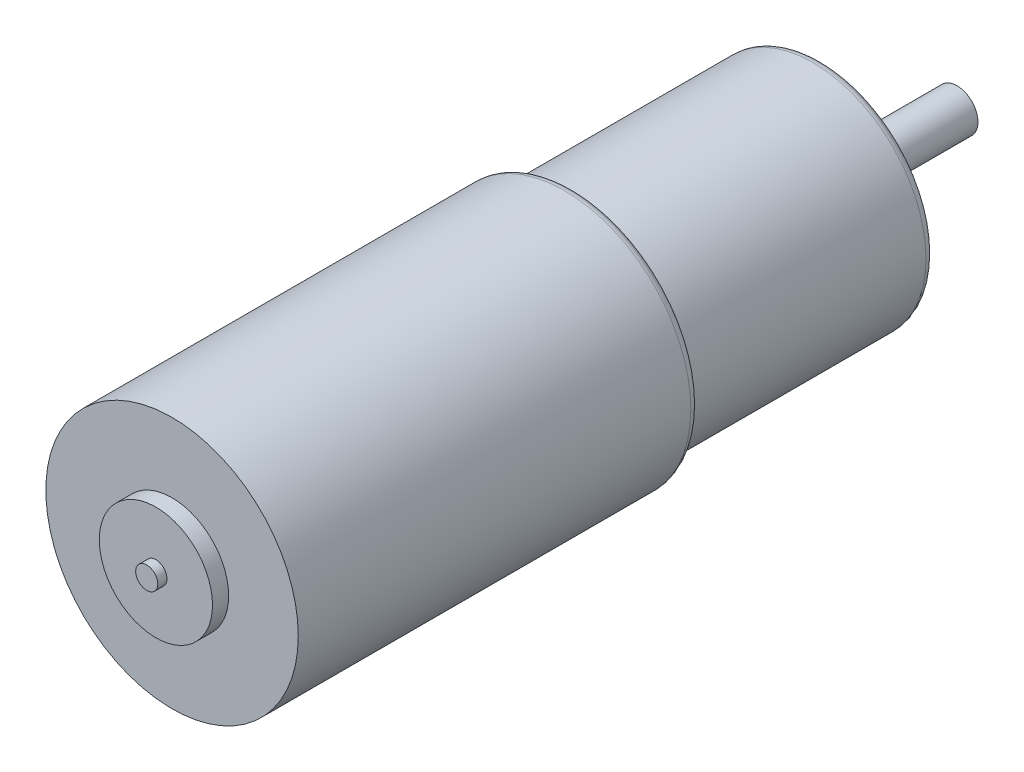
from build123d import *


# Read off the part's stored shape, not the designer's step: M3x0.5 Tapped Hole1
with BuildPart() as part:
    # Sketch1 → Revolve1 (revolve)
    with BuildSketch(Plane(origin=(0, 0, 0), x_dir=(0, 0, -1), z_dir=(1, 0, 0)), mode=Mode.PRIVATE) as revolve1_sk:
        with BuildLine():
            Line((111.125, 0), (111.125, 2.9718))
            Line((111.125, 2.9718), (94.9452, 2.9718))
            Line((94.9452, 2.9718), (94.9452, 9.9441))
            Line((94.9452, 9.9441), (91.9988, 9.9441))
            Line((91.9988, 9.9441), (91.9988, 14.732))
            ThreePointArc((91.9988, 14.732), (91.626825612, 15.630025612), (90.7288, 16.002))
            Line((90.7288, 16.002), (56.8452, 16.002))
            Line((56.8452, 16.002), (56.8452, 16.5989))
            ThreePointArc((56.8452, 16.5989), (56.473225612, 17.496925612), (55.5752, 17.8689))
            Line((55.5752, 17.8689), (0, 17.8689))
            Line((0, 17.8689), (0, 8.0137))
            Line((0, 8.0137), (-2.286, 8.0137))
            Line((-2.286, 8.0137), (-2.286, 1.5621))
            Line((-2.286, 1.5621), (-3.5814, 1.5621))
            Line((-3.5814, 1.5621), (-3.5814, 0))
            Line((-3.5814, 0), (111.125, 0))
        make_face()
    revolve(revolve1_sk.sketch.rotate(Axis((0, 0, 3.5814), (0, 0, -1)), 90), axis=Axis((0, 0, 3.5814), (0, 0, -1)))

    # M3x0.5 Tapped Hole1 outline → M3x0.5 Tapped Hole1 (revolve, cut)
    with BuildSketch(Plane(origin=(-9, -9, 0), x_dir=(1, 0, 0), z_dir=(0, -1, 0))):
        Polygon((1.25, -86.9188), (0, -86.167724226), (0, -91.9988), (1.25, -91.9988), align=None)
    revolve(axis=Axis((-9, -9, 0), (0, 0, 1)), mode=Mode.SUBTRACT)

    # M3x0.5 Tapped Hole1 2 outline → M3x0.5 Tapped Hole1 2 (revolve, cut)
    with BuildSketch(Plane(origin=(9, 9, 0), x_dir=(1, 0, 0), z_dir=(0, -1, 0))):
        Polygon((1.25, -86.9188), (0, -86.167724226), (0, -91.9988), (1.25, -91.9988), align=None)
    revolve(axis=Axis((9, 9, 0), (0, 0, 1)), mode=Mode.SUBTRACT)

    # M3x0.5 Tapped Hole1 3 outline → M3x0.5 Tapped Hole1 3 (revolve, cut)
    with BuildSketch(Plane(origin=(9, -9, 0), x_dir=(1, 0, 0), z_dir=(0, -1, 0))):
        Polygon((1.25, -86.9188), (0, -86.167724226), (0, -91.9988), (1.25, -91.9988), align=None)
    revolve(axis=Axis((9, -9, 0), (0, 0, 1)), mode=Mode.SUBTRACT)

    # M3x0.5 Tapped Hole1 4 outline → M3x0.5 Tapped Hole1 4 (revolve, cut)
    with BuildSketch(Plane(origin=(-9, 9, 0), x_dir=(1, 0, 0), z_dir=(0, -1, 0))):
        Polygon((1.25, -86.9188), (0, -86.167724226), (0, -91.9988), (1.25, -91.9988), align=None)
    revolve(axis=Axis((-9, 9, 0), (0, 0, 1)), mode=Mode.SUBTRACT)


solid = part.part
